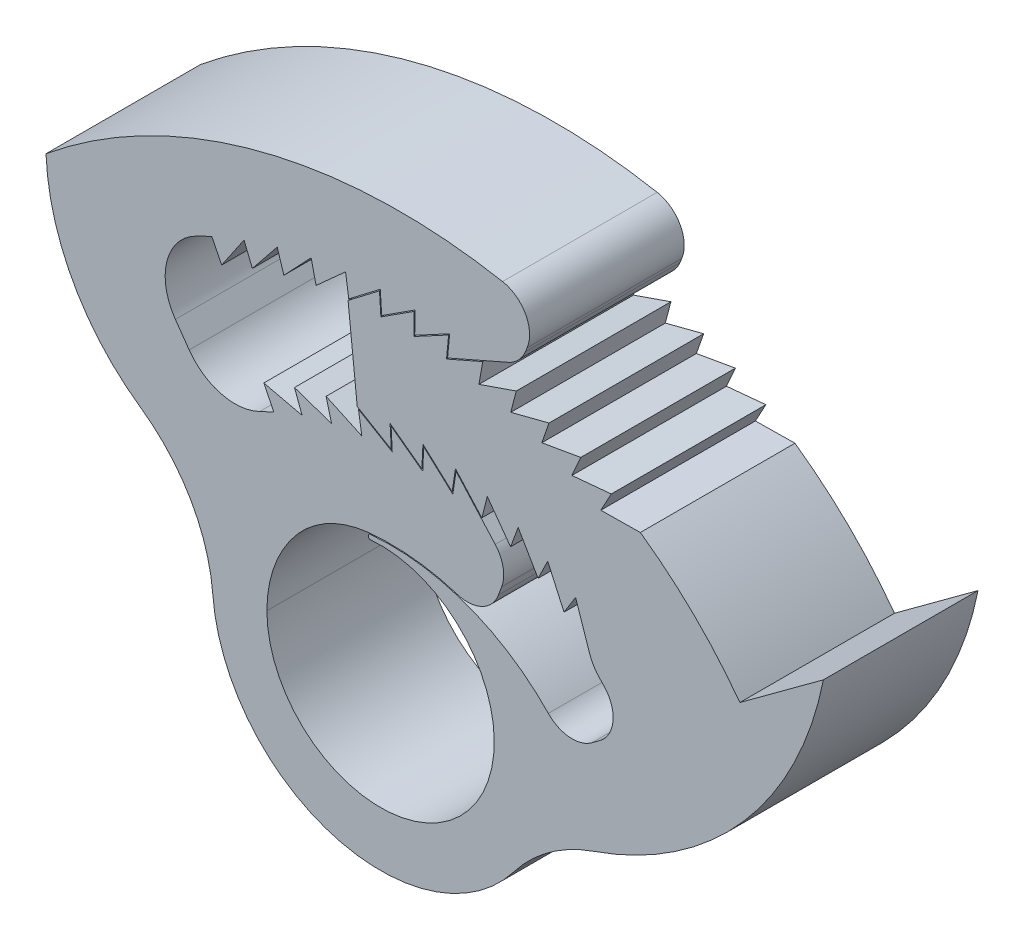
from build123d import *

# Parameters (mm, degrees)
BOSS_EXTRUDE1_DEPTH  = 2.159
BOSS_EXTRUDE2_DEPTH  = 2.159
CRVPATTERN14_START   = -2.159
CRVPATTERN14_DEPTH   = 4.318
BOSS_EXTRUDE3_DEPTH  = 2.159
BOSS_EXTRUDE12_START = -2.159
BOSS_EXTRUDE12_DEPTH = 4.318
BOSS_EXTRUDE4_DEPTH  = 2.159
CRVPATTERN15_START   = -2.159
CRVPATTERN15_DEPTH   = 4.318
BOSS_EXTRUDE6_DEPTH  = 2.159
BOSS_EXTRUDE8_DEPTH  = 2.159
FILLET6_R            = 1.2252325
BOSS_EXTRUDE7_DEPTH  = 2.159
CRVPATTERN16_COUNT   = 8
CRVPATTERN16_ANGLE   = 32.099318005
BOSS_EXTRUDE9_DEPTH  = 2.159
BOSS_EXTRUDE10_DEPTH = 2.159
CRVPATTERN17_START   = -2.159
CRVPATTERN17_DEPTH   = 4.318
FILLET7_R            = 1.56731187
BOSS_EXTRUDE11_DEPTH = 2.159
FILLET5_R            = 0.924207216
FILLET4_R            = 0.0508
FILLET8_R            = 4.7625


# Read off the part's stored shape, not the designer's step: CrvPattern14, CrvPattern15, CrvPattern17
with BuildPart() as part:
    # Sketch2 → Boss-Extrude1 (new, symmetric)
    with BuildSketch(Plane.XY):
        with BuildLine():
            Line((-0.345152986, 3.283911299), (-0.331877871, 3.157607018))
            ThreePointArc((-0.331877871, 3.157607018), (2.359484821, -2.124489675), (-3.175, 0))
            ThreePointArc((-3.175, 0), (-3.075214252, 0.826718033), (-2.78158852, 1.605950881))
            Line((-2.78158852, 1.605950881), (-4.069453372, 2.3495))
            ThreePointArc((-4.069453372, 2.3495), (-2.00731761, -4.248679443), (4.399194849, -1.65157067))
            Line((4.399194849, -1.65157067), (10.362922249, 2.734275533))
            ThreePointArc((10.362922249, 2.734275533), (9.973832009, 3.391907291), (9.541861687, 4.022202765))
            ThreePointArc((9.541861687, 4.022202765), (4.931855371, 7.722304078), (-0.907951479, 8.638581279))
            Line((-0.907951479, 8.638581279), (-0.651808138, 6.201540183))
            ThreePointArc((-0.651808138, 6.201540183), (3.941642024, 5.480818802), (7.56776097, 2.57040902))
            Line((7.56776097, 2.57040902), (5.204364932, 0.832319593))
            ThreePointArc((5.204364932, 0.832319593), (2.756157271, 2.797309609), (-0.345152986, 3.283911299))
        make_face()
    extrude(amount=BOSS_EXTRUDE1_DEPTH, both=True)

    # Sketch3 → Boss-Extrude2 (add, symmetric)
    with BuildSketch(Plane.XY):
        Polygon((-0.651808138, 6.201540183), (0.298358904, 5.639245785), (0.265388682, 6.250974184), (-0.392244602, 6.640151555), align=None)
    extrude(amount=BOSS_EXTRUDE2_DEPTH, both=True)

    # CrvPattern14 outline → CrvPattern14 (add)
    with BuildSketch(Plane.XY.offset(CRVPATTERN14_START)):
        with BuildLine():
            ThreePointArc((6.174117189, 4.072966487), (5.818003264, 4.363212667), (5.447590186, 4.634973821))
            Line((5.447590186, 4.634973821), (5.799283959, 3.588406151))
            Line((5.799283959, 3.588406151), (6.174117189, 4.072966487))
        make_face()
        with BuildLine():
            ThreePointArc((5.447590186, 4.634973821), (5.063836478, 4.88754671), (4.667735183, 5.120277749))
            Line((4.667735183, 5.120277749), (5.123914626, 4.114846143))
            Line((5.123914626, 4.114846143), (5.447590186, 4.634973821))
        make_face()
        with BuildLine():
            ThreePointArc((4.667735183, 5.120277749), (4.260311296, 5.332564697), (3.842619111, 5.523858218))
            Line((3.842619111, 5.523858218), (4.398565438, 4.569963004))
            Line((4.398565438, 4.569963004), (4.667735183, 5.120277749))
        make_face()
        with BuildLine():
            ThreePointArc((3.842619111, 5.523858218), (3.415739494, 5.693663299), (2.980777087, 5.841540535))
            Line((2.980777087, 5.841540535), (3.630739511, 4.949048941))
            Line((3.630739511, 4.949048941), (3.842619111, 5.523858218))
        make_face()
        with BuildLine():
            ThreePointArc((2.980777087, 5.841540535), (2.538857445, 5.967107261), (2.091124129, 6.070038548))
            Line((2.091124129, 6.070038548), (2.828379346, 5.248182634))
            Line((2.828379346, 5.248182634), (2.980777087, 5.841540535))
        make_face()
        with BuildLine():
            ThreePointArc((2.091124129, 6.070038548), (1.638735742, 6.150068039), (1.182862933, 6.206988641))
            Line((1.182862933, 6.206988641), (1.99978467, 5.464269802))
            Line((1.99978467, 5.464269802), (2.091124129, 6.070038548))
        make_face()
        with BuildLine():
            Line((0.265388682, 6.250974184), (1.153526584, 5.595075209))
            Line((1.153526584, 5.595075209), (1.182862933, 6.206988641))
            ThreePointArc((1.182862933, 6.206988641), (0.72468537, 6.240653061), (0.265388682, 6.250974184))
        make_face()
    extrude(amount=CRVPATTERN14_DEPTH)

    # Sketch6 → Boss-Extrude3 (add, symmetric)
    with BuildSketch(Plane.XY):
        with BuildLine():
            Line((-5.795109436, 2.930998085), (-4.193189288, 2.120793388))
            Line((-4.193189288, 2.120793388), (-2.78158852, 1.605950881))
            ThreePointArc((-2.78158852, 1.605950881), (-2.563325524, 1.968866129), (-2.302532257, 2.302532257))
            ThreePointArc((-2.302532257, 2.302532257), (-1.419579718, 2.989179637), (-0.347808009, 3.309172155))
            ThreePointArc((-0.347808009, 3.309172155), (0.982394739, 3.303690003), (2.280021634, 3.011057396))
            Line((2.280021634, 3.011057396), (2.834587117, 5.170248259))
            ThreePointArc((2.834587117, 5.170248259), (1.69609872, 5.447948005), (0.529939284, 5.563469196))
            ThreePointArc((0.529939284, 5.563469196), (-2.556537552, 5.065687863), (-5.243376004, 3.467243416))
            ThreePointArc((-5.243376004, 3.467243416), (-5.525424614, 3.205481193), (-5.795109436, 2.930998085))
        make_face()
    extrude(amount=BOSS_EXTRUDE3_DEPTH, both=True)

    # Sketch24 → Boss-Extrude12 (add)
    with BuildSketch(Plane.XY.offset(BOSS_EXTRUDE12_START)):
        with BuildLine():
            Line((-4.220330333, 2.13452054), (-2.859660878, 1.446333438))
            ThreePointArc((-2.859660878, 1.446333438), (-3.095249982, 0.74015525), (-3.175, 0))
            Line((-3.175, 0), (-4.699, 0))
            ThreePointArc((-4.699, 0), (-4.577864782, 1.093766724), (-4.220330333, 2.13452054))
        make_face()
    extrude(amount=BOSS_EXTRUDE12_DEPTH)

    # Sketch7 → Boss-Extrude4 (add, symmetric)
    with BuildSketch(Plane.XY):
        Polygon((2.841171549, 5.195884629), (2.108204785, 6.012959986), (2.013876484, 5.387369061), (1.956921428, 5.009639728), (2.76215236, 4.888224818), align=None)
    extrude(amount=BOSS_EXTRUDE4_DEPTH, both=True)

    # CrvPattern15 outline → CrvPattern15 (add)
    with BuildSketch(Plane.XY.offset(CRVPATTERN15_START)):
        with BuildLine():
            Line((-3.260742946, 5.465648477), (-2.97939475, 4.898987179))
            ThreePointArc((-2.97939475, 4.898987179), (-0.520320905, 5.527213901), (2.013876484, 5.387369061))
            Line((2.013876484, 5.387369061), (2.017822858, 5.413541649))
            Line((2.017822858, 5.413541649), (1.205652977, 6.151940254))
            Line((1.205652977, 6.151940254), (1.176624168, 5.546441646))
            Line((1.176624168, 5.546441646), (0.293652371, 6.1985254))
            Line((0.293652371, 6.1985254), (0.326276958, 5.593209885))
            Line((0.326276958, 5.593209885), (-0.61836317, 6.152233539))
            Line((-0.61836317, 6.152233539), (-0.524422659, 5.553362588))
            Line((-0.524422659, 5.553362588), (-1.520959625, 6.013543523))
            Line((-1.520959625, 6.013543523), (-1.366674925, 5.427311941))
            Line((-1.366674925, 5.427311941), (-2.404800409, 5.783889979))
            Line((-2.404800409, 5.783889979), (-2.191767463, 5.21636183))
            Line((-2.191767463, 5.21636183), (-3.260742946, 5.465648477))
        make_face()
    extrude(amount=CRVPATTERN15_DEPTH)

    # Sketch15 → Boss-Extrude6 (add, symmetric)
    with BuildSketch(Plane.XY):
        with BuildLine():
            Line((6.174117189, 4.072966487), (5.799283959, 3.588406151))
            Line((5.799283959, 3.588406151), (5.931866036, 3.193869408))
            ThreePointArc((5.931866036, 3.193869408), (6.446193236, 2.662565202), (6.910663393, 2.087166122))
            Line((6.910663393, 2.087166122), (7.56776097, 2.57040902))
            ThreePointArc((7.56776097, 2.57040902), (6.91369744, 3.361346752), (6.174117189, 4.072966487))
        make_face()
    extrude(amount=BOSS_EXTRUDE6_DEPTH, both=True)

    # Sketch20 → Boss-Extrude8 (add, symmetric)
    with BuildSketch(Plane.XY):
        with BuildLine():
            Line((2.841171549, 5.195884629), (3.574138313, 4.378809272))
            Line((3.574138313, 4.378809272), (2.9657089, 2.728197927))
            ThreePointArc((2.9657089, 2.728197927), (2.627152469, 2.880020383), (2.280021634, 3.011057396))
            Line((2.280021634, 3.011057396), (2.841171549, 5.195884629))
        make_face()
    extrude(amount=BOSS_EXTRUDE8_DEPTH, both=True)

    # Fillet6
    fillet6_edges = [part.edges().sort_by_distance(p)[0] for p in [
        (5.931866036, 3.193869408, 0),
    ]]
    fillet(fillet6_edges, radius=FILLET6_R)

    # Sketch16 → Boss-Extrude7 (add, symmetric)
    with BuildSketch(Plane.XY):
        Polygon((-0.907951479, 8.638581279), (-0.03080494, 9.30931519), (0.008805334, 8.697980833), (-0.59835021, 8.233702866), align=None)
    boss_extrude7 = extrude(amount=BOSS_EXTRUDE7_DEPTH, both=True)

    # CrvPattern16: Boss-Extrude7 ×8 about axis
    crvpattern16_axis = Axis((0.292208676, -2.780179842, 0), (0, 0, -1))
    for i in range(1, CRVPATTERN16_COUNT):
        add(boss_extrude7.rotate(crvpattern16_axis, i * CRVPATTERN16_ANGLE / (CRVPATTERN16_COUNT - 1)))

    # Sketch21 → Boss-Extrude9 (add, symmetric)
    with BuildSketch(Plane.XY):
        with BuildLine():
            Line((-6.320027167, 6.606343854), (-4.514811412, 4.043715892))
            ThreePointArc((-4.514811412, 4.043715892), (-5.183299194, 3.519963702), (-5.795109436, 2.930998085))
            Line((-5.795109436, 2.930998085), (-9.344214544, 7.969196961))
            ThreePointArc((-9.344214544, 7.969196961), (-3.396900447, 11.006572804), (3.275672454, 11.276698424))
            Line((3.275672454, 11.276698424), (2.886661012, 9.081631647))
            ThreePointArc((2.886661012, 9.081631647), (0.963406298, 9.34348497), (-0.976999989, 9.295533971))
            ThreePointArc((-0.976999989, 9.295533971), (-3.976201015, 8.587072836), (-6.700447257, 7.146376345))
            Line((-6.700447257, 7.146376345), (-6.320027167, 6.606343854))
        make_face()
    extrude(amount=BOSS_EXTRUDE9_DEPTH, both=True)

    # Sketch22 → Boss-Extrude10 (add, symmetric)
    with BuildSketch(Plane.XY):
        Polygon((2.886661012, 9.081631647), (2.670487492, 9.575318036), (1.930019742, 9.251084831), (1.871281039, 8.637020922), align=None)
    extrude(amount=BOSS_EXTRUDE10_DEPTH, both=True)

    # CrvPattern17 outline → CrvPattern17 (add)
    with BuildSketch(Plane.XY.offset(CRVPATTERN17_START)):
        with BuildLine():
            Line((-4.437083666, 7.73075431), (-3.813187634, 8.646957851))
            ThreePointArc((-3.813187634, 8.646957851), (-4.26705933, 8.473567533), (-4.713630949, 8.282158264))
            Line((-4.713630949, 8.282158264), (-4.437083666, 7.73075431))
        make_face()
        with BuildLine():
            Line((-3.581609613, 8.075209357), (-2.886461405, 8.938600437))
            ThreePointArc((-2.886461405, 8.938600437), (-3.352742578, 8.802051596), (-3.813187634, 8.646957851))
            Line((-3.813187634, 8.646957851), (-3.581609613, 8.075209357))
        make_face()
        with BuildLine():
            Line((-2.701335217, 8.350167761), (-1.939385201, 9.155218915))
            ThreePointArc((-1.939385201, 9.155218915), (-2.415090701, 9.056385741), (-2.886461405, 8.938600437))
            Line((-2.886461405, 8.938600437), (-2.701335217, 8.350167761))
        make_face()
        with BuildLine():
            Line((-1.801896032, 8.553869226), (-0.978022242, 9.295426484))
            ThreePointArc((-0.978022242, 9.295426484), (-1.460106582, 9.234941712), (-1.939385201, 9.155218915))
            Line((-1.939385201, 9.155218915), (-1.801896032, 8.553869226))
        make_face()
        with BuildLine():
            Line((-0.889050303, 8.685009647), (-0.008527213, 9.358325529))
            ThreePointArc((-0.008527213, 9.358325529), (-0.49390407, 9.336576385), (-0.978022242, 9.295426484))
            Line((-0.978022242, 9.295426484), (-0.889050303, 8.685009647))
        make_face()
        with BuildLine():
            Line((0.031357894, 8.742749459), (0.962893139, 9.343513369))
            ThreePointArc((0.962893139, 9.343513369), (0.477331168, 9.360639092), (-0.008527213, 9.358325529))
            Line((-0.008527213, 9.358325529), (0.031357894, 8.742749459))
        make_face()
        with BuildLine():
            Line((0.953436069, 8.726719008), (1.930019742, 9.251084831))
            ThreePointArc((1.930019742, 9.251084831), (1.447381243, 9.306975781), (0.962893139, 9.343513369))
            Line((0.962893139, 9.343513369), (0.953436069, 8.726719008))
        make_face()
    extrude(amount=CRVPATTERN17_DEPTH)

    # Fillet7
    fillet7_edges = [part.edges().sort_by_distance(p)[0] for p in [
        (-4.514811412, 4.043715892, 0),
        (-6.700447257, 7.146376345, 0),
    ]]
    fillet(fillet7_edges, radius=FILLET7_R)

    # Sketch23 → Boss-Extrude11 (add, symmetric)
    with BuildSketch(Plane.XY):
        with BuildLine():
            Line((10.362922249, 2.734275533), (4.399194849, -1.65157067))
            ThreePointArc((4.399194849, -1.65157067), (9.590201078, 0.983655797), (12.367362142, 6.100133162))
            Line((12.367362142, 6.100133162), (10.035011768, 4.384875346))
            ThreePointArc((10.035011768, 4.384875346), (8.755476597, 5.858878211), (7.255483957, 7.107844495))
            Line((7.255483957, 7.107844495), (6.151492239, 7.093891561))
            ThreePointArc((6.151492239, 7.093891561), (8.550099761, 5.197020468), (10.362922249, 2.734275533))
        make_face()
        with BuildLine():
            Line((2.886661012, 9.081631647), (3.902040986, 9.526242372))
            Line((3.902040986, 9.526242372), (4.508317815, 11.00637547))
            ThreePointArc((4.508317815, 11.00637547), (3.894731572, 11.154014824), (3.275672454, 11.276698424))
            Line((3.275672454, 11.276698424), (2.886661012, 9.081631647))
        make_face()
        with BuildLine():
            Line((-9.344214544, 7.969196961), (-5.795109436, 2.930998085))
            Line((-5.795109436, 2.930998085), (-4.220330333, 2.13452054))
            ThreePointArc((-4.220330333, 2.13452054), (-7.815223836, 4.144743604), (-9.344214544, 7.969196961))
        make_face()
    extrude(amount=BOSS_EXTRUDE11_DEPTH, both=True)

    # Fillet5
    fillet5_edges = [part.edges().sort_by_distance(p)[0] for p in [
        (5.204364932, 0.832319593, 0),
        (6.910663393, 2.087166122, 0),
        (2.9657089, 2.728197927, 0),
        (3.574138313, 4.378809272, 0),
        (4.508317815, 11.00637547, 0),
        (3.902040986, 9.526242372, 0),
    ]]
    fillet(fillet5_edges, radius=FILLET5_R)

    # Fillet4
    fillet4_edges = [part.edges().sort_by_distance(p)[0] for p in [
        (-0.331877871, 3.157607018, 0),
        (-0.345152986, 3.283911299, 0),
    ]]
    fillet(fillet4_edges, radius=FILLET4_R)

    # Fillet8
    fillet8_edges = [part.edges().sort_by_distance(p)[0] for p in [
        (4.399194849, -1.65157067, 0),
        (-4.220330333, 2.13452054, 0),
    ]]
    fillet(fillet8_edges, radius=FILLET8_R)


solid = part.part
